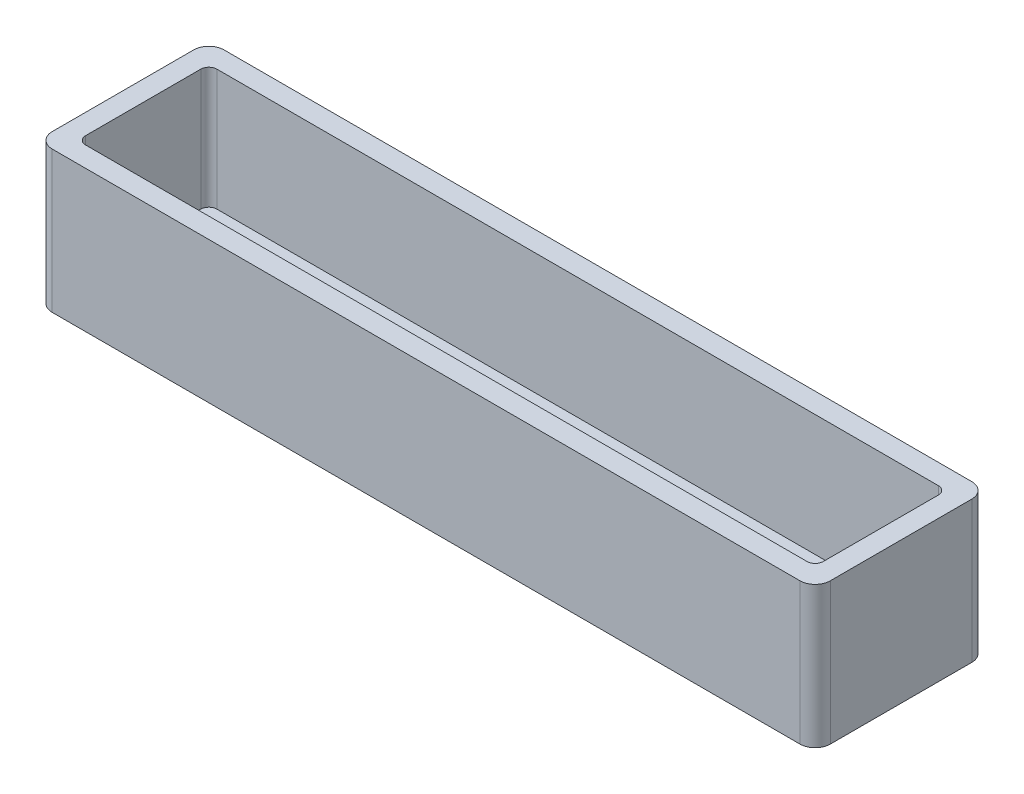
from build123d import *

# Parameters (mm, degrees)
SKETCH1_W           = 244.475
SKETCH1_H           = 53.975
SKETCH1_W_2         = 231.775
SKETCH1_H_2         = 41.275
BOSS_EXTRUDE1_DEPTH = 38.1
SKETCH2_W           = 244.475
SKETCH2_H           = 53.975
SKETCH2_R           = 12.065
BOSS_EXTRUDE2_DEPTH = 6.35
FILLET1_R           = 2.54
FILLET2_R           = 4.7625


with BuildPart() as part:
    # Sketch1 → Boss-Extrude1 (new body)
    with BuildSketch(Plane(origin=(0, 0, 0), x_dir=(1, 0, 0), z_dir=(0, 1, 0))):
        Rectangle(SKETCH1_W, SKETCH1_H)
        Rectangle(SKETCH1_W_2, SKETCH1_H_2, mode=Mode.SUBTRACT)
    extrude(amount=BOSS_EXTRUDE1_DEPTH)

    # Sketch2 → Boss-Extrude2 (add)
    with BuildSketch(Plane.XZ):
        Rectangle(SKETCH2_W, SKETCH2_H)
        with Locations((84.1375, 0)):
            Circle(SKETCH2_R, mode=Mode.SUBTRACT)
        with BuildLine():
            ThreePointArc((99.6375, -2.1), (101.7375, 0), (99.6375, 2.1))
            ThreePointArc((99.6375, 2.1), (97.5375, 0), (99.6375, -2.1))
        make_face(mode=Mode.SUBTRACT)
        with BuildLine():
            ThreePointArc((68.6375, -2.1), (70.7375, 0), (68.6375, 2.1))
            ThreePointArc((68.6375, 2.1), (66.5375, 0), (68.6375, -2.1))
        make_face(mode=Mode.SUBTRACT)
    extrude(amount=BOSS_EXTRUDE2_DEPTH)

    # Fillet1
    fillet1_edges = [part.edges().sort_by_distance(p)[0] for p in [
        (115.8875, 19.05, -20.6375),
        (115.8875, 19.05, 20.6375),
        (-115.8875, 19.05, 20.6375),
        (-115.8875, 19.05, -20.6375),
    ]]
    fillet(fillet1_edges, radius=FILLET1_R)

    # Fillet2
    fillet2_edges = [part.edges().sort_by_distance(p)[0] for p in [
        (-122.2375, 15.875, -26.9875),
        (122.2375, 15.875, -26.9875),
        (122.2375, 15.875, 26.9875),
        (-122.2375, 15.875, 26.9875),
    ]]
    fillet(fillet2_edges, radius=FILLET2_R)


solid = part.part
